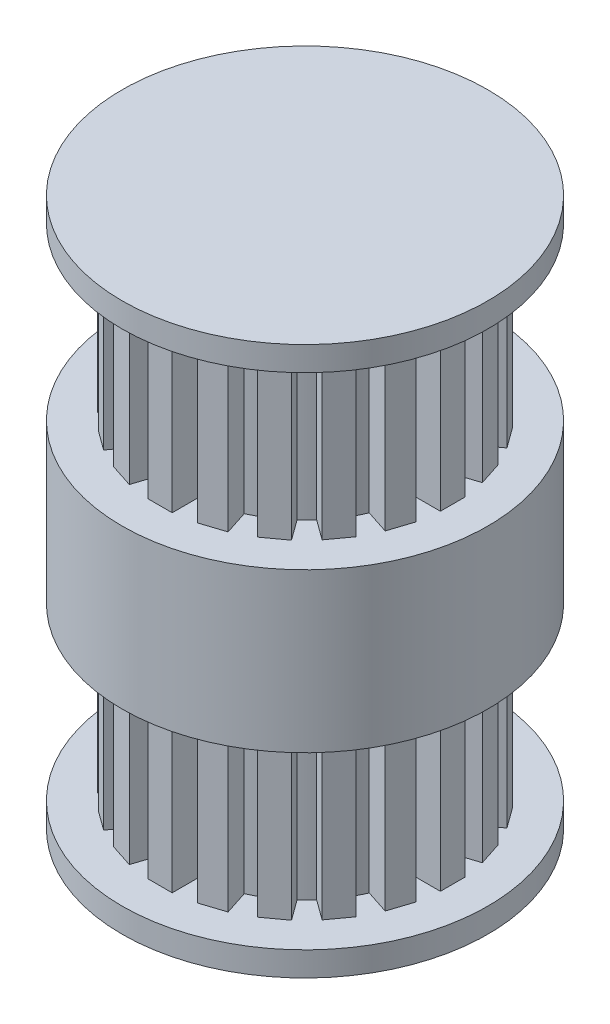
from build123d import *

# Parameters (mm, degrees)
IZIM1_R                     = 7.5
Y_KSEKLIK_EKSTR_ZYON1_DEPTH = 6.5
IZIM6_R                     = 5
Y_KSEKLIK_EKSTR_ZYON5_DEPTH = 7
Y_KSEKLIK_EKSTR_ZYON6_START = -7
Y_KSEKLIK_EKSTR_ZYON6_DEPTH = 7
DAIRESEL_KAPLAMA2_COUNT     = 20
IZIM8_R                     = 7.5
Y_KSEKLIK_EKSTR_ZYON7_DEPTH = 1
IZIM10_R                    = 1.2
KES_EKSTR_ZYON3_DEPTH       = 21
AYNALAMA1_START             = -7
AYNALAMA1_COPY_1_DEPTH      = 7
AYNALAMA1_COPY_2_DEPTH      = 7
AYNALAMA1_COPY_3_DEPTH      = 7
AYNALAMA1_COPY_4_DEPTH      = 7
AYNALAMA1_COPY_5_DEPTH      = 7
AYNALAMA1_COPY_6_DEPTH      = 7
AYNALAMA1_COPY_7_DEPTH      = 7
AYNALAMA1_COPY_8_DEPTH      = 7
AYNALAMA1_COPY_9_DEPTH      = 7
AYNALAMA1_COPY_10_DEPTH     = 7
AYNALAMA1_COPY_11_DEPTH     = 7
AYNALAMA1_COPY_12_DEPTH     = 7
AYNALAMA1_COPY_13_DEPTH     = 7
AYNALAMA1_COPY_14_DEPTH     = 7
AYNALAMA1_COPY_15_DEPTH     = 7
AYNALAMA1_COPY_16_DEPTH     = 7
AYNALAMA1_COPY_17_DEPTH     = 7
AYNALAMA1_COPY_18_DEPTH     = 7
AYNALAMA1_COPY_19_DEPTH     = 7


with BuildPart() as part:
    # Çizim1 → Yükseklik-Ekstrüzyon1 (new body)
    with BuildSketch(Plane(origin=(0, 0, 0), x_dir=(1, 0, 0), z_dir=(0, 1, 0))):
        Circle(IZIM1_R)
    extrude(amount=Y_KSEKLIK_EKSTR_ZYON1_DEPTH)

    # Çizim6 → Yükseklik-Ekstrüzyon5 (add)
    with BuildSketch(Plane(origin=(0, 6.5, 0), x_dir=(1, 0, 0), z_dir=(0, 1, 0))):
        Circle(IZIM6_R)
    y_kseklik_ekstr_zyon5 = extrude(amount=Y_KSEKLIK_EKSTR_ZYON5_DEPTH)

    # Çizim7 → Yükseklik-Ekstrüzyon6 (add)
    with BuildSketch(Plane(origin=(0, 13.5, 0), x_dir=(1, 0, 0), z_dir=(0, 1, 0)).offset(Y_KSEKLIK_EKSTR_ZYON6_START)):
        with BuildLine():
            ThreePointArc((-0.553189877, 4.969303871), (-0.053457869, 4.999714217), (0.446810123, 4.979996056))
            Line((0.446810123, 4.979996056), (0.446810123, 6))
            Line((0.446810123, 6), (-0.553189877, 6))
            Line((-0.553189877, 6), (-0.553189877, 4.969303871))
        make_face()
    y_kseklik_ekstr_zyon6 = extrude(amount=Y_KSEKLIK_EKSTR_ZYON6_DEPTH)

    # Dairesel Kaplama2: Yükseklik-Ekstrüzyon6 ×20 about axis
    dairesel_kaplama2_axis = Axis((0, 13.5, 0), (0, 1, 0))
    for i in range(1, DAIRESEL_KAPLAMA2_COUNT):
        add(y_kseklik_ekstr_zyon6.rotate(dairesel_kaplama2_axis, i * 360 / DAIRESEL_KAPLAMA2_COUNT))

    # Çizim8 → Yükseklik-Ekstrüzyon7 (add)
    with BuildSketch(Plane(origin=(0, 13.5, 0), x_dir=(1, 0, 0), z_dir=(0, 1, 0))):
        Circle(IZIM8_R)
    y_kseklik_ekstr_zyon7 = extrude(amount=Y_KSEKLIK_EKSTR_ZYON7_DEPTH)

    # Çizim10 → Kes-Ekstrüzyon3 (cut)
    with BuildSketch(Plane(origin=(0, 0, 0), x_dir=(0, 0, -1), z_dir=(1, 0, 0))):
        with Locations((0, 2.361227205)):
            Circle(IZIM10_R)
    extrude(amount=-KES_EKSTR_ZYON3_DEPTH, mode=Mode.SUBTRACT)

    # Aynalama1: Yükseklik-Ekstrüzyon6, Yükseklik-Ekstrüzyon7 across plane
    add(y_kseklik_ekstr_zyon6.mirror(Plane(origin=(0, 3.25, 0), x_dir=(0, 0, 1), z_dir=(0, -1, 0))))
    add(y_kseklik_ekstr_zyon7.mirror(Plane(origin=(0, 3.25, 0), x_dir=(0, 0, 1), z_dir=(0, -1, 0))))

    # Aynalama1 copy 1 sketch → Aynalama1 copy 1 (add)
    with BuildSketch(Plane(origin=(0, -7, 0), x_dir=(0.9510565162951535, 0, -0.3090169943749474), z_dir=(0, -1, 0)).offset(AYNALAMA1_START)):
        with BuildLine():
            ThreePointArc((-0.553189877, -4.969303871), (-0.053457869, -4.999714217), (0.446810123, -4.979996056))
            Line((0.446810123, -4.979996056), (0.446810123, -6))
            Line((0.446810123, -6), (-0.553189877, -6))
            Line((-0.553189877, -6), (-0.553189877, -4.969303871))
        make_face()
    extrude(amount=AYNALAMA1_COPY_1_DEPTH)

    # Aynalama1 copy 2 sketch → Aynalama1 copy 2 (add)
    with BuildSketch(Plane(origin=(0, -7, 0), x_dir=(0.8090169943749475, 0, -0.5877852522924731), z_dir=(0, -1, 0)).offset(AYNALAMA1_START)):
        with BuildLine():
            ThreePointArc((-0.553189877, -4.969303871), (-0.053457869, -4.999714217), (0.446810123, -4.979996056))
            Line((0.446810123, -4.979996056), (0.446810123, -6))
            Line((0.446810123, -6), (-0.553189877, -6))
            Line((-0.553189877, -6), (-0.553189877, -4.969303871))
        make_face()
    extrude(amount=AYNALAMA1_COPY_2_DEPTH)

    # Aynalama1 copy 3 sketch → Aynalama1 copy 3 (add)
    with BuildSketch(Plane(origin=(0, -7, 0), x_dir=(0.5877852522924731, 0, -0.8090169943749475), z_dir=(0, -1, 0)).offset(AYNALAMA1_START)):
        with BuildLine():
            ThreePointArc((-0.553189877, -4.969303871), (-0.053457869, -4.999714217), (0.446810123, -4.979996056))
            Line((0.446810123, -4.979996056), (0.446810123, -6))
            Line((0.446810123, -6), (-0.553189877, -6))
            Line((-0.553189877, -6), (-0.553189877, -4.969303871))
        make_face()
    extrude(amount=AYNALAMA1_COPY_3_DEPTH)

    # Aynalama1 copy 4 sketch → Aynalama1 copy 4 (add)
    with BuildSketch(Plane(origin=(0, -7, 0), x_dir=(0.30901699437494745, 0, -0.9510565162951535), z_dir=(0, -1, 0)).offset(AYNALAMA1_START)):
        with BuildLine():
            ThreePointArc((-0.553189877, -4.969303871), (-0.053457869, -4.999714217), (0.446810123, -4.979996056))
            Line((0.446810123, -4.979996056), (0.446810123, -6))
            Line((0.446810123, -6), (-0.553189877, -6))
            Line((-0.553189877, -6), (-0.553189877, -4.969303871))
        make_face()
    extrude(amount=AYNALAMA1_COPY_4_DEPTH)

    # Aynalama1 copy 5 sketch → Aynalama1 copy 5 (add)
    with BuildSketch(Plane(origin=(0, -7, 0), x_dir=(0, 0, -1), z_dir=(0, -1, 0)).offset(AYNALAMA1_START)):
        with BuildLine():
            ThreePointArc((-0.553189877, -4.969303871), (-0.053457869, -4.999714217), (0.446810123, -4.979996056))
            Line((0.446810123, -4.979996056), (0.446810123, -6))
            Line((0.446810123, -6), (-0.553189877, -6))
            Line((-0.553189877, -6), (-0.553189877, -4.969303871))
        make_face()
    extrude(amount=AYNALAMA1_COPY_5_DEPTH)

    # Aynalama1 copy 6 sketch → Aynalama1 copy 6 (add)
    with BuildSketch(Plane(origin=(0, -7, 0), x_dir=(-0.30901699437494734, 0, -0.9510565162951536), z_dir=(0, -1, 0)).offset(AYNALAMA1_START)):
        with BuildLine():
            ThreePointArc((-0.553189877, -4.969303871), (-0.053457869, -4.999714217), (0.446810123, -4.979996056))
            Line((0.446810123, -4.979996056), (0.446810123, -6))
            Line((0.446810123, -6), (-0.553189877, -6))
            Line((-0.553189877, -6), (-0.553189877, -4.969303871))
        make_face()
    extrude(amount=AYNALAMA1_COPY_6_DEPTH)

    # Aynalama1 copy 7 sketch → Aynalama1 copy 7 (add)
    with BuildSketch(Plane(origin=(0, -7, 0), x_dir=(-0.587785252292473, 0, -0.8090169943749475), z_dir=(0, -1, 0)).offset(AYNALAMA1_START)):
        with BuildLine():
            ThreePointArc((-0.553189877, -4.969303871), (-0.053457869, -4.999714217), (0.446810123, -4.979996056))
            Line((0.446810123, -4.979996056), (0.446810123, -6))
            Line((0.446810123, -6), (-0.553189877, -6))
            Line((-0.553189877, -6), (-0.553189877, -4.969303871))
        make_face()
    extrude(amount=AYNALAMA1_COPY_7_DEPTH)

    # Aynalama1 copy 8 sketch → Aynalama1 copy 8 (add)
    with BuildSketch(Plane(origin=(0, -7, 0), x_dir=(-0.8090169943749473, 0, -0.5877852522924732), z_dir=(0, -1, 0)).offset(AYNALAMA1_START)):
        with BuildLine():
            ThreePointArc((-0.553189877, -4.969303871), (-0.053457869, -4.999714217), (0.446810123, -4.979996056))
            Line((0.446810123, -4.979996056), (0.446810123, -6))
            Line((0.446810123, -6), (-0.553189877, -6))
            Line((-0.553189877, -6), (-0.553189877, -4.969303871))
        make_face()
    extrude(amount=AYNALAMA1_COPY_8_DEPTH)

    # Aynalama1 copy 9 sketch → Aynalama1 copy 9 (add)
    with BuildSketch(Plane(origin=(0, -7, 0), x_dir=(-0.9510565162951535, 0, -0.3090169943749475), z_dir=(0, -1, 0)).offset(AYNALAMA1_START)):
        with BuildLine():
            ThreePointArc((-0.553189877, -4.969303871), (-0.053457869, -4.999714217), (0.446810123, -4.979996056))
            Line((0.446810123, -4.979996056), (0.446810123, -6))
            Line((0.446810123, -6), (-0.553189877, -6))
            Line((-0.553189877, -6), (-0.553189877, -4.969303871))
        make_face()
    extrude(amount=AYNALAMA1_COPY_9_DEPTH)

    # Aynalama1 copy 10 sketch → Aynalama1 copy 10 (add)
    with BuildSketch(Plane(origin=(0, -7, 0), x_dir=(-1, 0, 0), z_dir=(0, -1, 0)).offset(AYNALAMA1_START)):
        with BuildLine():
            ThreePointArc((-0.553189877, -4.969303871), (-0.053457869, -4.999714217), (0.446810123, -4.979996056))
            Line((0.446810123, -4.979996056), (0.446810123, -6))
            Line((0.446810123, -6), (-0.553189877, -6))
            Line((-0.553189877, -6), (-0.553189877, -4.969303871))
        make_face()
    extrude(amount=AYNALAMA1_COPY_10_DEPTH)

    # Aynalama1 copy 11 sketch → Aynalama1 copy 11 (add)
    with BuildSketch(Plane(origin=(0, -7, 0), x_dir=(-0.9510565162951536, 0, 0.3090169943749473), z_dir=(0, -1, 0)).offset(AYNALAMA1_START)):
        with BuildLine():
            ThreePointArc((-0.553189877, -4.969303871), (-0.053457869, -4.999714217), (0.446810123, -4.979996056))
            Line((0.446810123, -4.979996056), (0.446810123, -6))
            Line((0.446810123, -6), (-0.553189877, -6))
            Line((-0.553189877, -6), (-0.553189877, -4.969303871))
        make_face()
    extrude(amount=AYNALAMA1_COPY_11_DEPTH)

    # Aynalama1 copy 12 sketch → Aynalama1 copy 12 (add)
    with BuildSketch(Plane(origin=(0, -7, 0), x_dir=(-0.8090169943749476, 0, 0.587785252292473), z_dir=(0, -1, 0)).offset(AYNALAMA1_START)):
        with BuildLine():
            ThreePointArc((-0.553189877, -4.969303871), (-0.053457869, -4.999714217), (0.446810123, -4.979996056))
            Line((0.446810123, -4.979996056), (0.446810123, -6))
            Line((0.446810123, -6), (-0.553189877, -6))
            Line((-0.553189877, -6), (-0.553189877, -4.969303871))
        make_face()
    extrude(amount=AYNALAMA1_COPY_12_DEPTH)

    # Aynalama1 copy 13 sketch → Aynalama1 copy 13 (add)
    with BuildSketch(Plane(origin=(0, -7, 0), x_dir=(-0.5877852522924732, 0, 0.8090169943749473), z_dir=(0, -1, 0)).offset(AYNALAMA1_START)):
        with BuildLine():
            ThreePointArc((-0.553189877, -4.969303871), (-0.053457869, -4.999714217), (0.446810123, -4.979996056))
            Line((0.446810123, -4.979996056), (0.446810123, -6))
            Line((0.446810123, -6), (-0.553189877, -6))
            Line((-0.553189877, -6), (-0.553189877, -4.969303871))
        make_face()
    extrude(amount=AYNALAMA1_COPY_13_DEPTH)

    # Aynalama1 copy 14 sketch → Aynalama1 copy 14 (add)
    with BuildSketch(Plane(origin=(0, -7, 0), x_dir=(-0.30901699437494756, 0, 0.9510565162951535), z_dir=(0, -1, 0)).offset(AYNALAMA1_START)):
        with BuildLine():
            ThreePointArc((-0.553189877, -4.969303871), (-0.053457869, -4.999714217), (0.446810123, -4.979996056))
            Line((0.446810123, -4.979996056), (0.446810123, -6))
            Line((0.446810123, -6), (-0.553189877, -6))
            Line((-0.553189877, -6), (-0.553189877, -4.969303871))
        make_face()
    extrude(amount=AYNALAMA1_COPY_14_DEPTH)

    # Aynalama1 copy 15 sketch → Aynalama1 copy 15 (add)
    with BuildSketch(Plane(origin=(0, -7, 0), x_dir=(0, 0, 1), z_dir=(0, -1, 0)).offset(AYNALAMA1_START)):
        with BuildLine():
            ThreePointArc((-0.553189877, -4.969303871), (-0.053457869, -4.999714217), (0.446810123, -4.979996056))
            Line((0.446810123, -4.979996056), (0.446810123, -6))
            Line((0.446810123, -6), (-0.553189877, -6))
            Line((-0.553189877, -6), (-0.553189877, -4.969303871))
        make_face()
    extrude(amount=AYNALAMA1_COPY_15_DEPTH)

    # Aynalama1 copy 16 sketch → Aynalama1 copy 16 (add)
    with BuildSketch(Plane(origin=(0, -7, 0), x_dir=(0.30901699437494723, 0, 0.9510565162951536), z_dir=(0, -1, 0)).offset(AYNALAMA1_START)):
        with BuildLine():
            ThreePointArc((-0.553189877, -4.969303871), (-0.053457869, -4.999714217), (0.446810123, -4.979996056))
            Line((0.446810123, -4.979996056), (0.446810123, -6))
            Line((0.446810123, -6), (-0.553189877, -6))
            Line((-0.553189877, -6), (-0.553189877, -4.969303871))
        make_face()
    extrude(amount=AYNALAMA1_COPY_16_DEPTH)

    # Aynalama1 copy 17 sketch → Aynalama1 copy 17 (add)
    with BuildSketch(Plane(origin=(0, -7, 0), x_dir=(0.5877852522924729, 0, 0.8090169943749476), z_dir=(0, -1, 0)).offset(AYNALAMA1_START)):
        with BuildLine():
            ThreePointArc((-0.553189877, -4.969303871), (-0.053457869, -4.999714217), (0.446810123, -4.979996056))
            Line((0.446810123, -4.979996056), (0.446810123, -6))
            Line((0.446810123, -6), (-0.553189877, -6))
            Line((-0.553189877, -6), (-0.553189877, -4.969303871))
        make_face()
    extrude(amount=AYNALAMA1_COPY_17_DEPTH)

    # Aynalama1 copy 18 sketch → Aynalama1 copy 18 (add)
    with BuildSketch(Plane(origin=(0, -7, 0), x_dir=(0.8090169943749473, 0, 0.5877852522924734), z_dir=(0, -1, 0)).offset(AYNALAMA1_START)):
        with BuildLine():
            ThreePointArc((-0.553189877, -4.969303871), (-0.053457869, -4.999714217), (0.446810123, -4.979996056))
            Line((0.446810123, -4.979996056), (0.446810123, -6))
            Line((0.446810123, -6), (-0.553189877, -6))
            Line((-0.553189877, -6), (-0.553189877, -4.969303871))
        make_face()
    extrude(amount=AYNALAMA1_COPY_18_DEPTH)

    # Aynalama1 copy 19 sketch → Aynalama1 copy 19 (add)
    with BuildSketch(Plane(origin=(0, -7, 0), x_dir=(0.9510565162951535, 0, 0.3090169943749476), z_dir=(0, -1, 0)).offset(AYNALAMA1_START)):
        with BuildLine():
            ThreePointArc((-0.553189877, -4.969303871), (-0.053457869, -4.999714217), (0.446810123, -4.979996056))
            Line((0.446810123, -4.979996056), (0.446810123, -6))
            Line((0.446810123, -6), (-0.553189877, -6))
            Line((-0.553189877, -6), (-0.553189877, -4.969303871))
        make_face()
    extrude(amount=AYNALAMA1_COPY_19_DEPTH)

    # Aynalama2: Yükseklik-Ekstrüzyon5 across plane
    add(y_kseklik_ekstr_zyon5.mirror(Plane(origin=(0, 3.25, 0), x_dir=(0, 0, 1), z_dir=(0, -1, 0))))


solid = part.part
